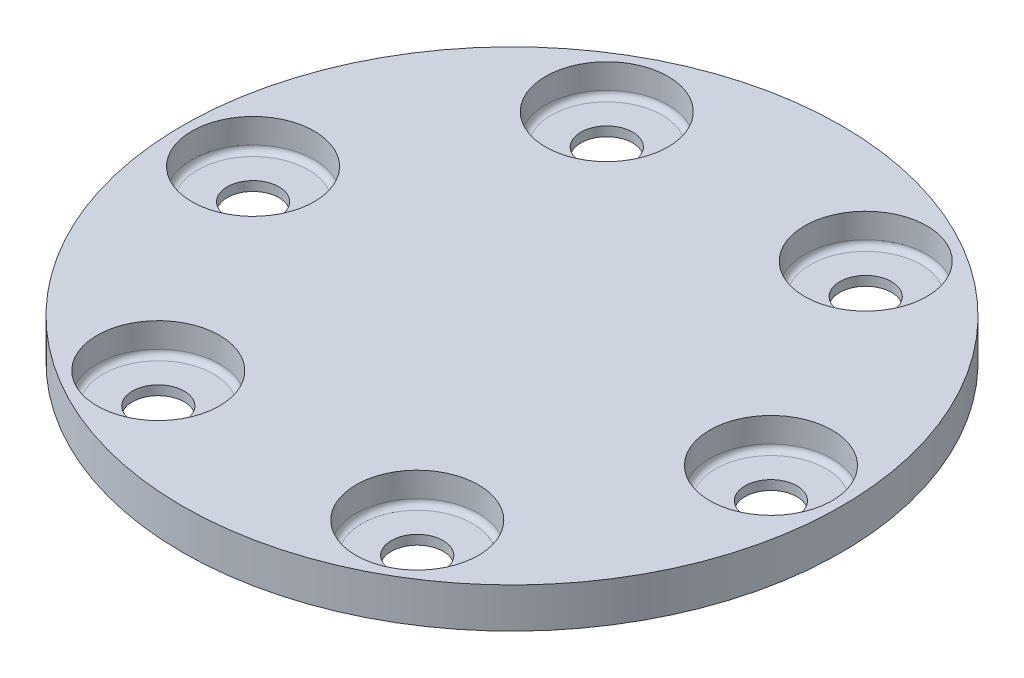
from build123d import *

# Parameters (mm, degrees)
SKETCH1_R           = 14
BOSS_EXTRUDE1_DEPTH = 1.7
CIRPATTERN1_COUNT   = 6
FILLET1_R           = 0.25


with BuildPart() as part:
    # Sketch1 → Boss-Extrude1 (new body)
    with BuildSketch(Plane(origin=(0, 0, 0), x_dir=(1, 0, 0), z_dir=(0, 1, 0))):
        Circle(SKETCH1_R)
    extrude(amount=BOSS_EXTRUDE1_DEPTH)

    # Sketch14 → CBORE for M5 Hex Head Bolt1 (revolve, cut)
    with BuildSketch(Plane(origin=(-11, 1.7, 0), x_dir=(0, 0, 1), z_dir=(1, 0, 0))):
        Polygon((0, 0), (0, 5.660946681), (1.1, 5), (1.1, 1.3), (2.6, 1.3), (2.6, 0), align=None)
    cbore_for_m5_hex_head_bolt1 = revolve(axis=Axis((-11, 8.05, 0), (0, -1, 0)), mode=Mode.SUBTRACT)

    # CirPattern1: CBORE for M5 Hex Head Bolt1 ×6 about axis
    cirpattern1_axis = Axis((0, 1.7, 0), (0, 1, 0))
    for i in range(1, CIRPATTERN1_COUNT):
        add(cbore_for_m5_hex_head_bolt1.rotate(cirpattern1_axis, i * 360 / CIRPATTERN1_COUNT), mode=Mode.SUBTRACT)

    # Fillet1
    fillet1_edges = [part.edges().sort_by_distance(p)[0] for p in [
        (-11, 0.4, -2.6),
        (7.75166605, 0.4, -8.226279442),
        (-3.24833395, 0.4, -10.826279442),
        (-7.75166605, 0.4, 8.226279442),
        (3.24833395, 0.4, 10.826279442),
        (11, 0.4, 2.6),
    ]]
    fillet(fillet1_edges, radius=FILLET1_R)


solid = part.part
